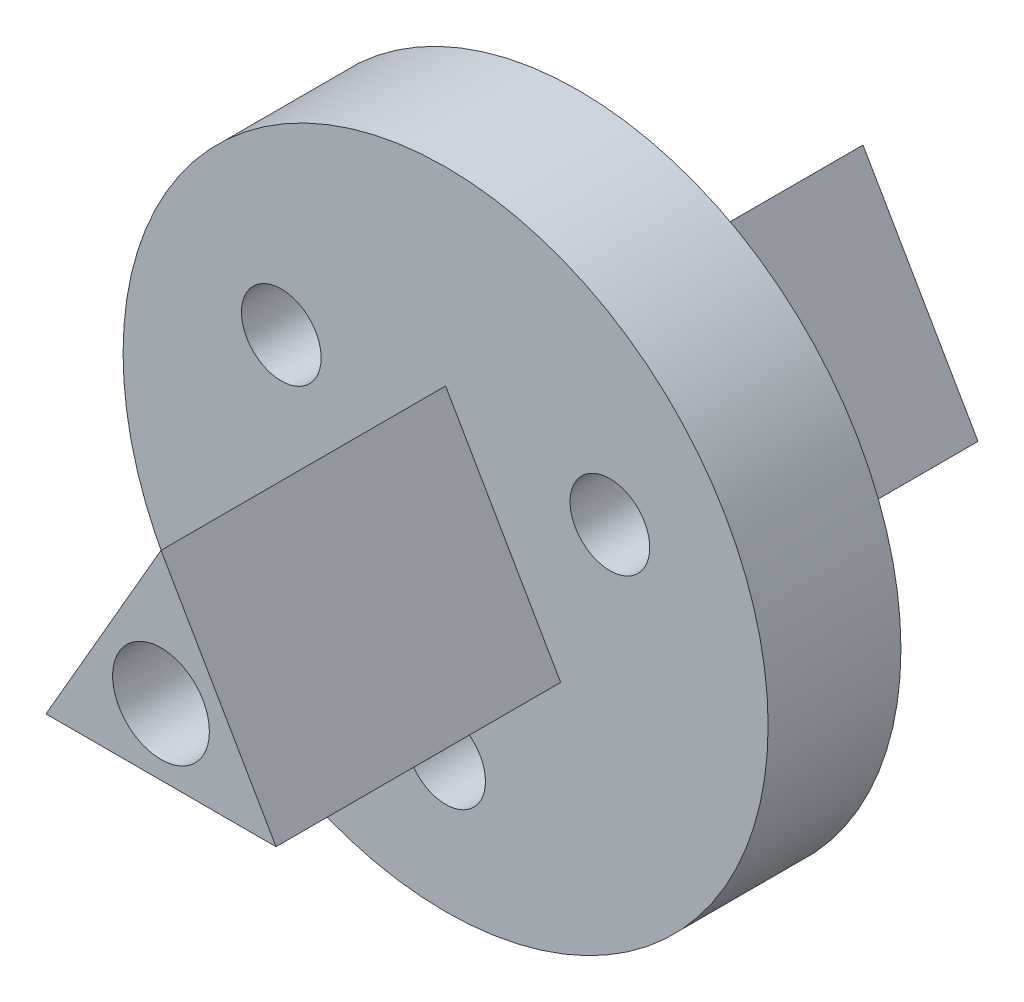
from build123d import *

# Parameters (mm, degrees)
SKETCH3_R                = 17
SKETCH3_R_2              = 2.1
BOSS_EXTRUDE1_DEPTH      = 7
BOSS_EXTRUDE2_DEPTH      = 15
BOSS_EXTRUDE2_DEPTH_BACK = 22
SKETCH4_R                = 2.55
SKETCH9_R                = 2.55
CUT_EXTRUDE1_DEPTH       = 33.588341474


with BuildPart() as part:
    # Sketch3 → Boss-Extrude1 (new body)
    with BuildSketch(Plane.XY):
        Circle(SKETCH3_R)
        with Locations((8.660254038, 5)):
            Circle(SKETCH3_R_2, mode=Mode.SUBTRACT)
        with Locations((0, -10)):
            Circle(SKETCH3_R_2, mode=Mode.SUBTRACT)
        with Locations((-8.660254038, 5)):
            Circle(SKETCH3_R_2, mode=Mode.SUBTRACT)
    extrude(amount=BOSS_EXTRUDE1_DEPTH)

    # Sketch4 → Boss-Extrude2 (add, two sides: drawn at the far end of the back side and taken through both)
    with BuildSketch(Plane.XY.offset(7).offset(-BOSS_EXTRUDE2_DEPTH_BACK)):
        Polygon((0, 7), (6.062177826, -3.5), (-6.062177826, -3.5), align=None)
        Circle(SKETCH4_R, mode=Mode.SUBTRACT)
    extrude(amount=BOSS_EXTRUDE2_DEPTH + BOSS_EXTRUDE2_DEPTH_BACK)

    # Sketch9 → Cut-Extrude1 (cut, through all)
    with BuildSketch(Plane.XY.offset(7)):
        Circle(SKETCH9_R)
    extrude(amount=-CUT_EXTRUDE1_DEPTH, mode=Mode.SUBTRACT)


solid = part.part
